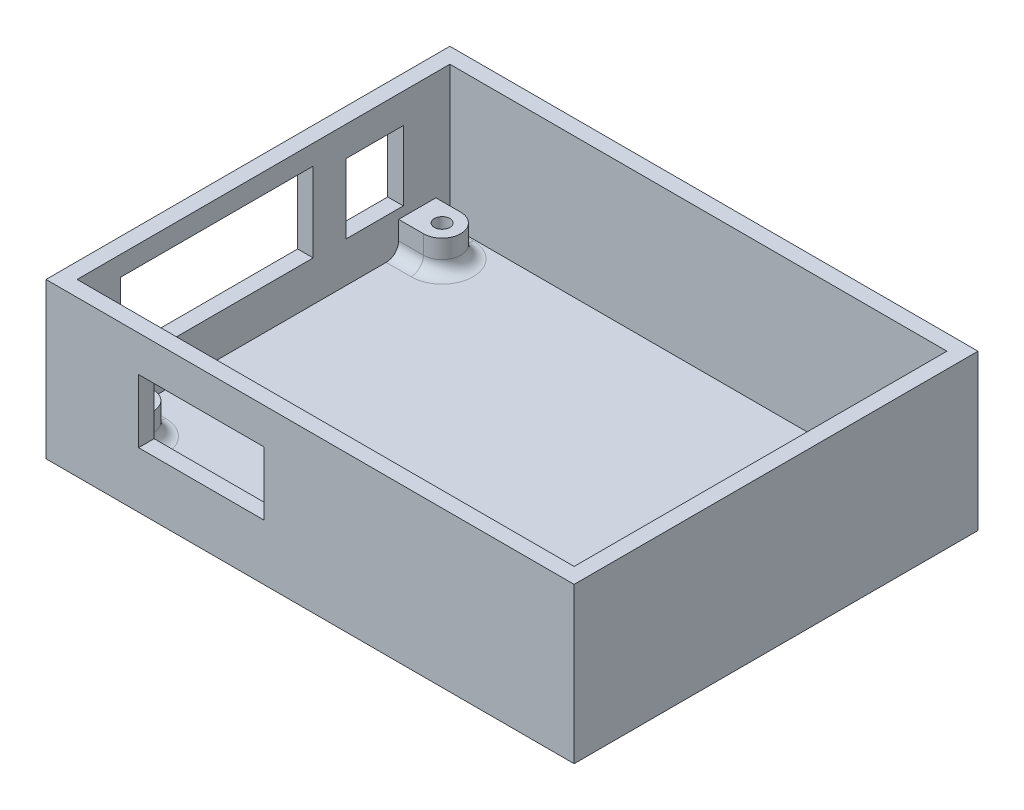
from build123d import *

# Parameters (mm, degrees)
SKETCH_1_W          = 85
SKETCH_1_H          = 65
EXTRUDE_1_DEPTH     = 25
SHELL_1_T           = -2.5
SKETCH_2_R          = 3
SKETCH_2_R_2        = 1.25
EXTRUDE_2_DEPTH     = 5
SKETCH_3_W          = 20.2
SKETCH_3_H          = 10.2
CUT_EXTRUDE_1_DEPTH = 80.60841664
SKETCH_4_W          = 9.2
SKETCH_4_H          = 11.2
SKETCH_4_W_2        = 31
SKETCH_4_H_2        = 12.8
CUT_EXTRUDE_2_DEPTH = 93.127628863
FILLET_1_R          = 2


with BuildPart() as part:
    # 草图1 → 凸台-拉伸1 (new body)
    with BuildSketch(Plane(origin=(0, 0, 0), x_dir=(1, 0, 0), z_dir=(0, 1, 0))):
        Rectangle(SKETCH_1_W, SKETCH_1_H)
    extrude(amount=EXTRUDE_1_DEPTH)

    # 抽壳1
    shell_1_openings = [part.faces().sort_by_distance(p)[0] for p in [
        (0, 25, 0),
    ]]
    offset(amount=SHELL_1_T, openings=shell_1_openings, kind=Kind.INTERSECTION)

    # 草图2 → 凸台-拉伸2 (add)
    # profile 1 of 4: a face of its own
    with BuildSketch(Plane(origin=(0, 2.5, 0), x_dir=(1, 0, 0), z_dir=(0, 1, 0))):
        with Locations((32, 24.75)):
            Circle(SKETCH_2_R)
        with Locations((32, 24.75)):
            Circle(SKETCH_2_R_2, mode=Mode.SUBTRACT)
    # profile 2 of 4: a face of its own
    with BuildSketch(Plane(origin=(0, 2.5, 0), x_dir=(1, 0, 0), z_dir=(0, 1, 0))):
        with Locations((32, -24.75)):
            Circle(SKETCH_2_R)
        with Locations((32, -24.75)):
            Circle(SKETCH_2_R_2, mode=Mode.SUBTRACT)
    # profile 3 of 4: a face of its own
    with BuildSketch(Plane(origin=(0, 2.5, 0), x_dir=(1, 0, 0), z_dir=(0, 1, 0))):
        with BuildLine():
            Line((-36, 27.75), (-40, 27.75))
            Line((-40, 27.75), (-40, 21.75))
            Line((-40, 21.75), (-36, 21.75))
            ThreePointArc((-36, 21.75), (-33, 24.75), (-36, 27.75))
        make_face()
        with Locations((-36, 24.75)):
            Circle(SKETCH_2_R_2, mode=Mode.SUBTRACT)
    # profile 4 of 4: a face of its own
    with BuildSketch(Plane(origin=(0, 2.5, 0), x_dir=(1, 0, 0), z_dir=(0, 1, 0))):
        with BuildLine():
            Line((-36, -21.75), (-40, -21.75))
            Line((-40, -21.75), (-40, -27.75))
            Line((-40, -27.75), (-36, -27.75))
            ThreePointArc((-36, -27.75), (-33, -24.75), (-36, -21.75))
        make_face()
        with Locations((-36, -24.75)):
            Circle(SKETCH_2_R_2, mode=Mode.SUBTRACT)
    extrude(amount=EXTRUDE_2_DEPTH)

    # 草图3 → 切除-拉伸1 (cut, through all)
    with BuildSketch(Plane(origin=(0, 0, 30), x_dir=(-1, 0, 0), z_dir=(0, 0, -1))):
        with Locations((17.5, 14.1)):
            Rectangle(SKETCH_3_W, SKETCH_3_H)
    extrude(amount=-CUT_EXTRUDE_1_DEPTH, mode=Mode.SUBTRACT)

    # 草图4 → 切除-拉伸2 (cut, through all)
    with BuildSketch(Plane(origin=(-40, 0, 0), x_dir=(0, 0, -1), z_dir=(1, 0, 0))):
        with Locations((17.9, 14.6)):
            Rectangle(SKETCH_4_W, SKETCH_4_H)
        with Locations((-7.5, 15.4)):
            Rectangle(SKETCH_4_W_2, SKETCH_4_H_2)
    extrude(amount=-CUT_EXTRUDE_2_DEPTH, mode=Mode.SUBTRACT)

    # 圆角1
    fillet_1_edges = [part.edges().sort_by_distance(p)[0] for p in [
        (29, 2.5, -24.75),
        (29, 2.5, 24.75),
        (-38, 2.5, -21.75),
        (-38, 2.5, -27.75),
        (-38, 2.5, 27.75),
        (-38, 2.5, 21.75),
        (-33, 2.5, -24.75),
        (-33, 2.5, 24.75),
    ]]
    fillet(fillet_1_edges, radius=FILLET_1_R)


solid = part.part
